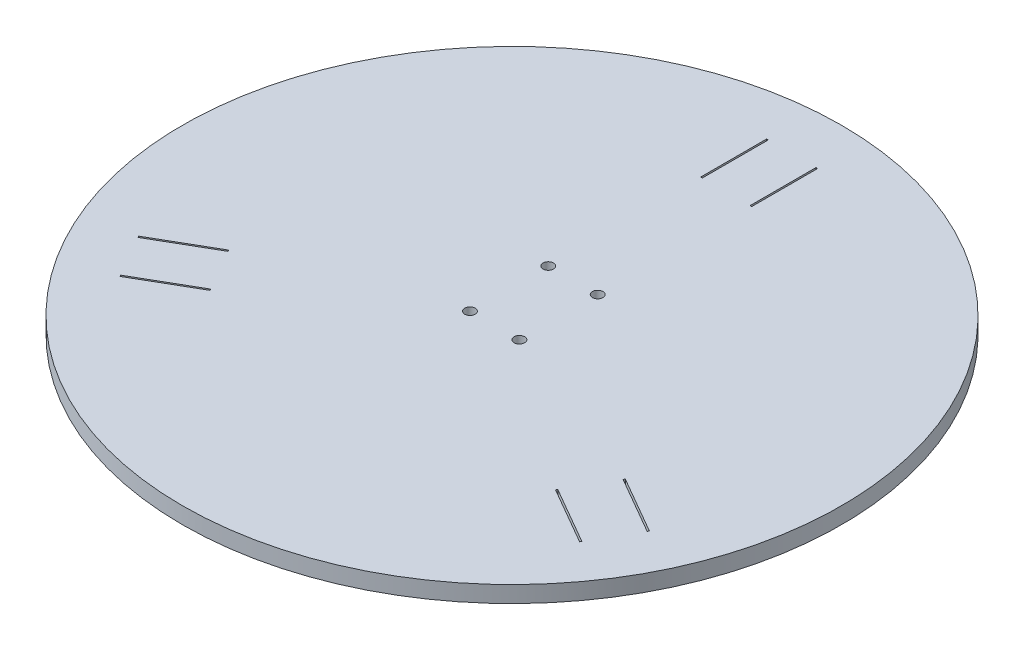
from build123d import *

# Parameters (mm, degrees)
SKETCH2_R                            = 100
BOSS_EXTRUDE1_DEPTH                  = 5
SKETCH3_W                            = 0.5
SKETCH3_H                            = 20
CUT_EXTRUDE1_DEPTH                   = 142.509716981
F_3_2_3_2_DIAMETER_HOLE1_D           = 3.2
F_3_2_3_2_DIAMETER_HOLE1_CSINK_D     = 3.25
F_3_2_3_2_DIAMETER_HOLE1_CSINK_ANGLE = 90


with BuildPart() as part:
    # Sketch2 → Boss-Extrude1 (new body)
    with BuildSketch(Plane(origin=(0, 0, 0), x_dir=(1, 0, 0), z_dir=(0, 1, 0))):
        Circle(SKETCH2_R)
    extrude(amount=BOSS_EXTRUDE1_DEPTH)

    # Sketch3 → Cut-Extrude1 (cut, through all)
    with BuildSketch(Plane(origin=(0, 5, 0), x_dir=(1, 0, 0), z_dir=(0, 1, 0))):
        with Locations((-7.5, 75)):
            Rectangle(SKETCH3_W, SKETCH3_H)
        with Locations((7.5, 75)):
            Rectangle(SKETCH3_W, SKETCH3_H)
        Polygon((60.166651246, -25.788303121), (77.487159322, -35.788303121), (77.237159322, -36.221315823), (59.916651246, -26.221315823), align=None)
        Polygon((52.666651246, -38.778684177), (69.987159322, -48.778684177), (69.737159322, -49.211696879), (52.416651246, -39.211696879), align=None)
        Polygon((-52.416651246, -39.211696879), (-69.737159322, -49.211696879), (-69.987159322, -48.778684177), (-52.666651246, -38.778684177), align=None)
        Polygon((-59.916651246, -26.221315823), (-77.237159322, -36.221315823), (-77.487159322, -35.788303121), (-60.166651246, -25.788303121), align=None)
    extrude(amount=-CUT_EXTRUDE1_DEPTH, mode=Mode.SUBTRACT)

    # Ø3.2 (3.2) Diameter Hole1 (through all)
    with Locations(Plane(origin=(0, 0, 0), x_dir=(-1, 0, 0), z_dir=(0, -1, 0))):
        with Locations((-7.5, 18.5), (7.5, 18.5), (7.5, -5.25), (-7.5, -5.25)):
            CounterSinkHole(F_3_2_3_2_DIAMETER_HOLE1_D / 2, F_3_2_3_2_DIAMETER_HOLE1_CSINK_D / 2, counter_sink_angle=F_3_2_3_2_DIAMETER_HOLE1_CSINK_ANGLE)


solid = part.part
